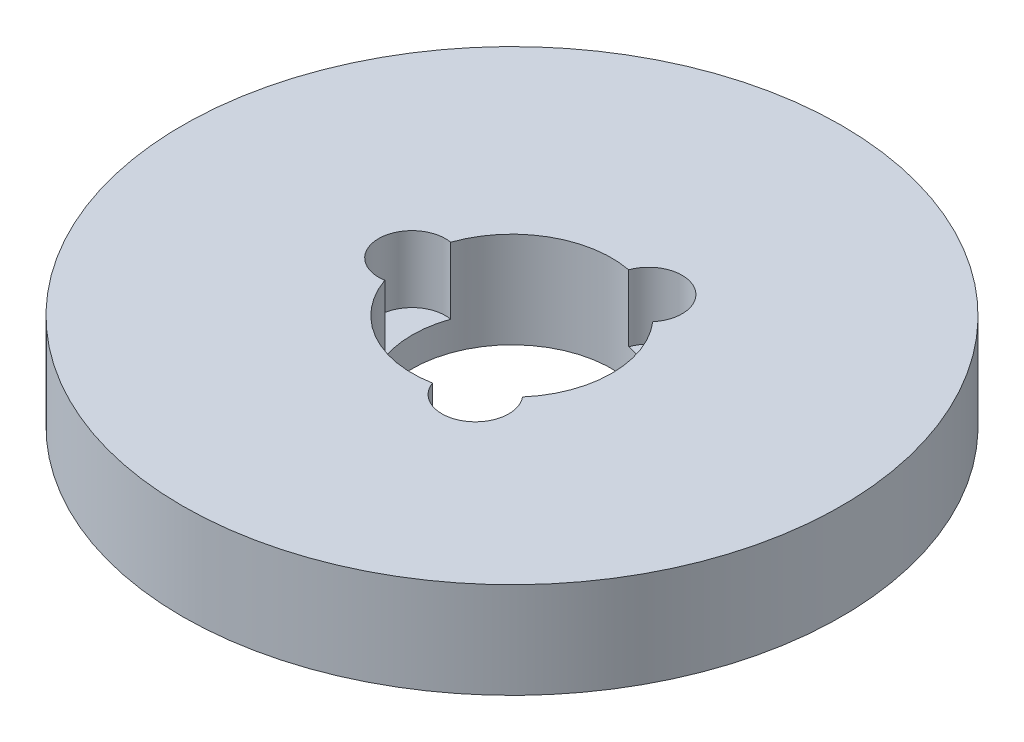
from build123d import *

# Parameters (mm, degrees)
SKETCH1_R           = 82.5
BOSS_EXTRUDE1_DEPTH = 24
SKETCH2_R           = 25
CUT_EXTRUDE1_DEPTH  = 120.115490177
SKETCH3_R           = 8.373747647
CUT_EXTRUDE2_DEPTH  = 16.688027159
CIRPATTERN1_COUNT   = 3


with BuildPart() as part:
    # Sketch1 → Boss-Extrude1 (new body)
    with BuildSketch(Plane(origin=(0, 0, 0), x_dir=(1, 0, 0), z_dir=(0, 1, 0))):
        Circle(SKETCH1_R)
    extrude(amount=BOSS_EXTRUDE1_DEPTH)

    # Sketch2 → Cut-Extrude1 (cut, through all)
    with BuildSketch(Plane(origin=(0, 0, 0), x_dir=(1, 0, 0), z_dir=(0, 1, 0))):
        Circle(SKETCH2_R)
    extrude(amount=CUT_EXTRUDE1_DEPTH, mode=Mode.SUBTRACT)

    # Sketch3 → Cut-Extrude2 (cut)
    with BuildSketch(Plane(origin=(0, 24, 0), x_dir=(1, 0, 0), z_dir=(0, 1, 0))):
        with Locations((-25.039053832, 0)):
            Circle(SKETCH3_R)
    cut_extrude2 = extrude(amount=-CUT_EXTRUDE2_DEPTH, mode=Mode.SUBTRACT)

    # CirPattern1: Cut-Extrude2 ×3 about axis
    cirpattern1_axis = Axis((0, 0, 0), (0, 1, 0))
    for i in range(1, CIRPATTERN1_COUNT):
        add(cut_extrude2.rotate(cirpattern1_axis, i * 360 / CIRPATTERN1_COUNT), mode=Mode.SUBTRACT)


solid = part.part
